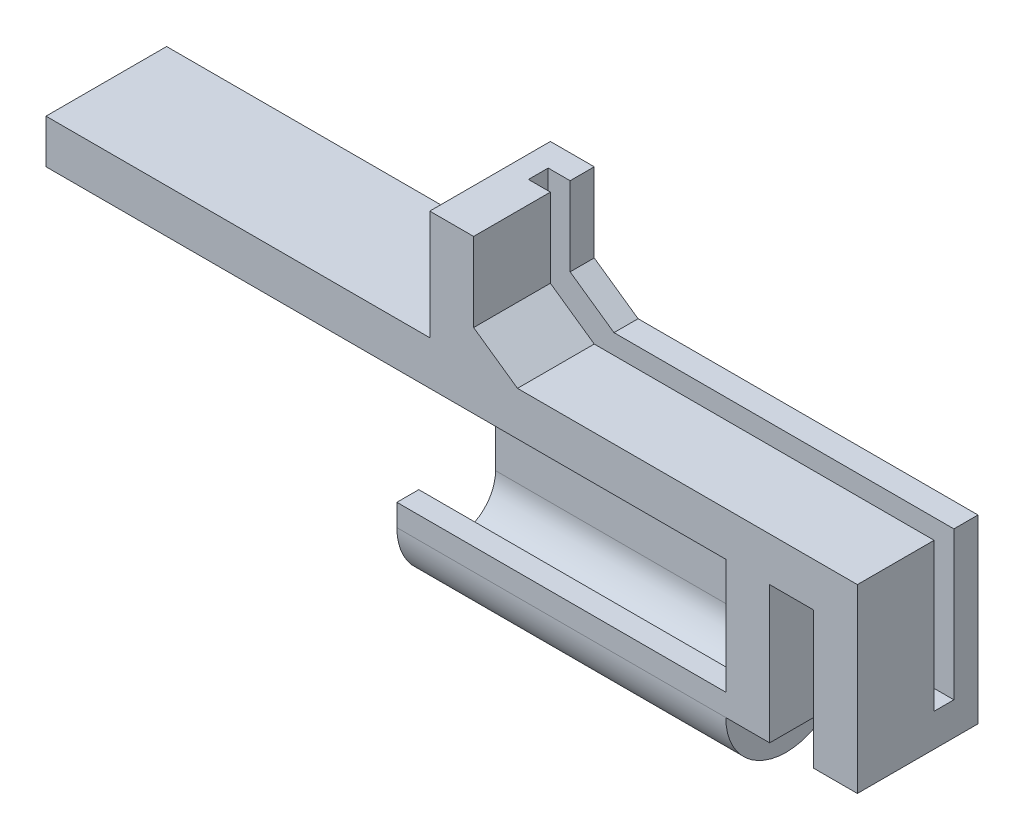
from build123d import *
from OCP.BRepFilletAPI import BRepFilletAPI_MakeChamfer

# Parameters (mm, degrees)
SKETCH1_W           = 5.5
SKETCH1_H           = 2
BOSS_EXTRUDE1_DEPTH = 37
BOSS_EXTRUDE2_START = 35
SKETCH1_3_W         = 5.5
SKETCH1_3_H         = 6.25
BOSS_EXTRUDE2_DEPTH = 2
BOSS_EXTRUDE3_START = 31
SKETCH1_4_W         = 5.5
SKETCH1_4_H         = 6.25
BOSS_EXTRUDE3_DEPTH = 2
BOSS_EXTRUDE5_START = 16
BOSS_EXTRUDE5_DEPTH = 15
SKETCH2_W           = 2
SKETCH2_H           = 5.5
BOSS_EXTRUDE6_DEPTH = 5
SKETCH3_W           = 0.9
SKETCH3_H           = 12.159990002
CUT_EXTRUDE1_DEPTH  = 18.5
CHAMFER1_SIZE2      = 2
CHAMFER1_SIZE       = 1.400415076
CHAMFER2_SIZE       = 2
CHAMFER2_SIZE2      = 1.400415076


with BuildPart() as part:
    # Sketch1 → Boss-Extrude1 (new body)
    with BuildSketch(Plane(origin=(0, 0, 0), x_dir=(0, 0, -1), z_dir=(1, 0, 0))):
        with Locations((2.75, 7.25)):
            Rectangle(SKETCH1_W, SKETCH1_H)
    extrude(amount=BOSS_EXTRUDE1_DEPTH)

    # Sketch1<3> → Boss-Extrude2 (add)
    with BuildSketch(Plane(origin=(0, 0, 0), x_dir=(0, 0, -1), z_dir=(1, 0, 0)).offset(BOSS_EXTRUDE2_START)):
        with Locations((2.75, 3.125)):
            Rectangle(SKETCH1_3_W, SKETCH1_3_H)
    extrude(amount=BOSS_EXTRUDE2_DEPTH)

    # Sketch1<4> → Boss-Extrude3 (add)
    with BuildSketch(Plane(origin=(0, 0, 0), x_dir=(0, 0, -1), z_dir=(1, 0, 0)).offset(BOSS_EXTRUDE3_START)):
        with Locations((2.75, 3.125)):
            Rectangle(SKETCH1_4_W, SKETCH1_4_H)
    extrude(amount=BOSS_EXTRUDE3_DEPTH)

    # Sketch1<6> → Boss-Extrude5 (add)
    with BuildSketch(Plane(origin=(0, 0, 0), x_dir=(0, 0, -1), z_dir=(1, 0, 0)).offset(BOSS_EXTRUDE5_START)):
        with BuildLine():
            Line((0, 1), (0, 0))
            ThreePointArc((0, 0), (2.75, -2.75), (5.5, 0))
            Line((5.5, 0), (5.5, 6.25))
            Line((5.5, 6.25), (4.5, 6.25))
            Line((4.5, 6.25), (4.5, 0))
            ThreePointArc((4.5, 0), (2.75, -1.75), (1, 0))
            Line((1, 0), (1, 1))
            Line((1, 1), (0, 1))
        make_face()
    extrude(amount=BOSS_EXTRUDE5_DEPTH)

    # Sketch2 → Boss-Extrude6 (add)
    with BuildSketch(Plane(origin=(0, 8.25, 0), x_dir=(1, 0, 0), z_dir=(0, 1, 0))):
        with Locations((18.5, 2.75)):
            Rectangle(SKETCH2_W, SKETCH2_H)
    extrude(amount=BOSS_EXTRUDE6_DEPTH)

    # Sketch3 → Cut-Extrude1 (cut)
    with BuildSketch(Plane(origin=(37, 0, 0), x_dir=(0, 0, -1), z_dir=(1, 0, 0))):
        with Locations((3.95, 7.579995001)):
            Rectangle(SKETCH3_W, SKETCH3_H)
    extrude(amount=-CUT_EXTRUDE1_DEPTH, mode=Mode.SUBTRACT)

    # Chamfer1
    chamfer1_edges = [part.edges().sort_by_distance(p)[0] for p in [
        (31, 1.5, -3.95),
    ]]
    chamfer1_side = [part.faces().sort_by_distance(p)[0] for p in [
        (31, 1.471991698, -3.95),
    ]]
    chamfer(chamfer1_edges, length=CHAMFER1_SIZE - 0.0001, length2=CHAMFER1_SIZE2 - 0.0001, reference=chamfer1_side[0])  # a hair under: the kernel refuses the full size

    # Chamfer2: one chamfer whose edges measure the first distance from different faces: ONE call of the kernel's chamfer builder (chamfer() names one face for all edges)
    chamfer2_edges_1 = [part.edges().sort_by_distance(p)[0] for p in [
        (19.5, 8.25, -1.75),
    ]]
    chamfer2_side_1 = [part.faces().sort_by_distance(p)[0] for p in [
        (28.25, 8.25, -1.75),
    ]]
    chamfer2_edges_2 = [part.edges().sort_by_distance(p)[0] for p in [
        (19.5, 8.25, -4.95),
    ]]
    chamfer2_side_2 = [part.faces().sort_by_distance(p)[0] for p in [
        (28.25, 8.25, -4.95),
    ]]
    chamfer2 = BRepFilletAPI_MakeChamfer(part.part.solid().wrapped)
    for e in chamfer2_edges_1:
        chamfer2.Add(CHAMFER2_SIZE, CHAMFER2_SIZE2, e.wrapped, chamfer2_side_1[0].wrapped)  # the first distance lies on this face
    for e in chamfer2_edges_2:
        chamfer2.Add(CHAMFER2_SIZE, CHAMFER2_SIZE2, e.wrapped, chamfer2_side_2[0].wrapped)  # the first distance lies on this face
    add(Compound.cast(chamfer2.Shape()), mode=Mode.REPLACE)


solid = part.part
